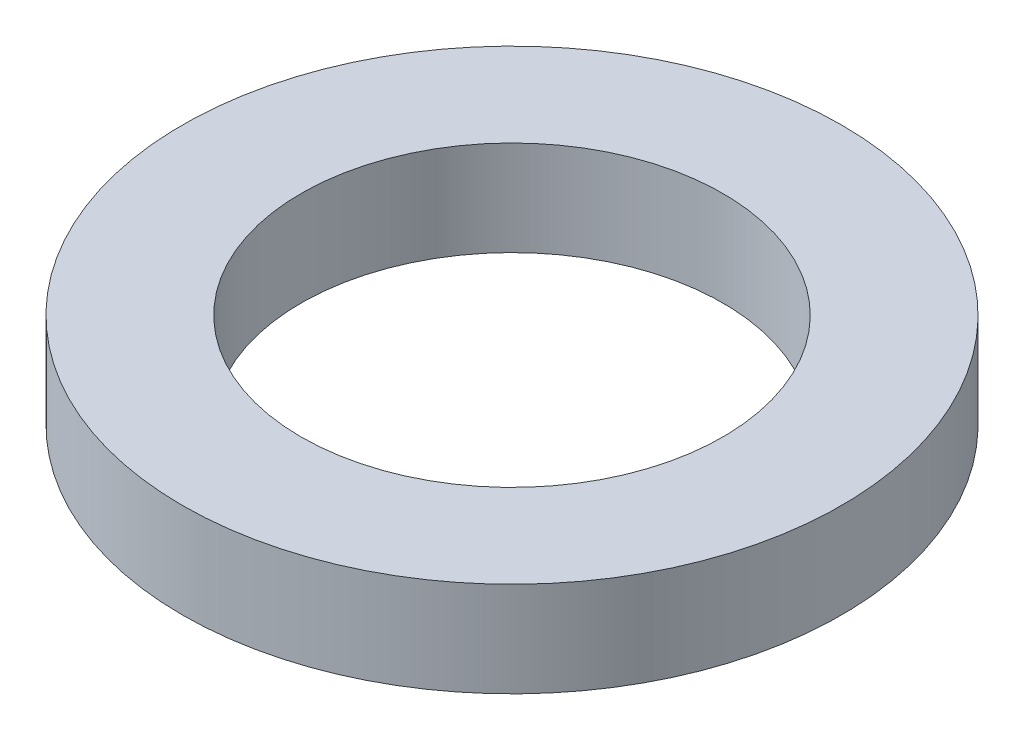
from build123d import *

# Parameters (mm, degrees)
SKETCH1_R           = 62.5
BOSS_EXTRUDE1_DEPTH = 18
SKETCH2_R           = 40
CUT_EXTRUDE1_DEPTH  = 91.202549853


with BuildPart() as part:
    # Sketch1 → Boss-Extrude1 (new body)
    with BuildSketch(Plane(origin=(0, 0, 0), x_dir=(1, 0, 0), z_dir=(0, 1, 0))):
        Circle(SKETCH1_R)
    extrude(amount=BOSS_EXTRUDE1_DEPTH)

    # Sketch2 → Cut-Extrude1 (cut, through all)
    with BuildSketch(Plane(origin=(0, 0, 0), x_dir=(1, 0, 0), z_dir=(0, 1, 0))):
        Circle(SKETCH2_R)
    extrude(amount=CUT_EXTRUDE1_DEPTH, mode=Mode.SUBTRACT)


solid = part.part
